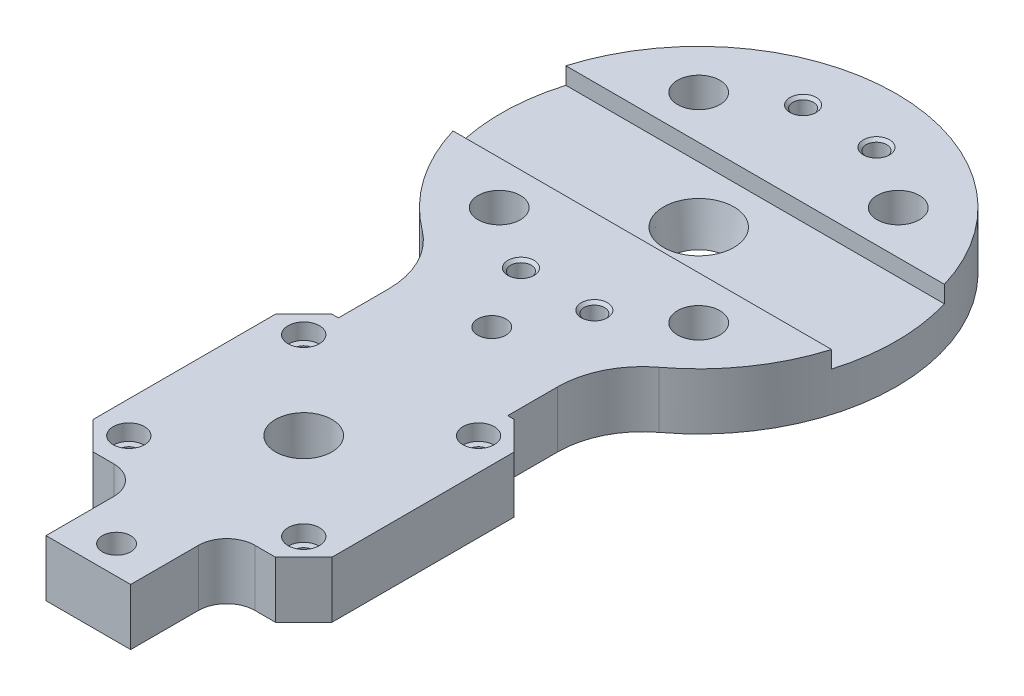
from build123d import *

# Parameters (mm, degrees)
SKETCH1_R                                      = 35
BOSS_EXTRUDE1_DEPTH                            = 10
SKETCH3_R                                      = 3.75
CUT_EXTRUDE1_DEPTH                             = 10
SKETCH4_R                                      = 5
BOSS_EXTRUDE2_DEPTH                            = 10
CBORE_FOR_4_SOCKET_HEAD_CAP_SCREW1_D           = 3.2639
CBORE_FOR_4_SOCKET_HEAD_CAP_SCREW1_CBORE_D     = 5.55752
CBORE_FOR_4_SOCKET_HEAD_CAP_SCREW1_CBORE_DEPTH = 2.8448
CHAMFER1_SIZE                                  = 5
SKETCH9_R                                      = 11.43
CUT_EXTRUDE5_DEPTH                             = 2.54
FILLET2_R                                      = 15
FILLET3_R                                      = 5
SKETCH16_R                                     = 5
CUT_EXTRUDE9_DEPTH                             = 115.130403048
CUT_EXTRUDE9_DRAFT                             = 10
SKETCH12_R                                     = 2.5
CUT_EXTRUDE6_DEPTH                             = 115.130403048
CBORE_FOR_M4_SHCS1_OUTLINE_R                   = 4.003586442
CBORE_FOR_M4_SHCS1_OUTLINE_R_2                 = 2.5
CBORE_FOR_M4_SHCS1_DEPTH                       = 4
SKETCH22_W                                     = 80
SKETCH22_H                                     = 20
CUT_EXTRUDE11_DEPTH                            = 3
SKETCH23_R                                     = 1.825
CUT_EXTRUDE12_DEPTH                            = 7
CHAMFER2_SIZE                                  = 0.5


# Read off the part's stored shape, not the designer's step: CBORE for M4 SHCS1
with BuildPart() as part:
    # Sketch1 → Boss-Extrude1 (new body)
    with BuildSketch(Plane(origin=(0, 0, 0), x_dir=(1, 0, 0), z_dir=(0, 1, 0))):
        with Locations(Location((0, 0, 0), (0, 0, 270))):
            Circle(SKETCH1_R)
    extrude(amount=BOSS_EXTRUDE1_DEPTH)

    # Sketch3 → Cut-Extrude1 (cut)
    with BuildSketch(Plane(origin=(0, 10, 0), x_dir=(1, 0, 0), z_dir=(0, 1, 0))):
        with Locations(Location((-17.67766953, 17.67766953, 0), (0, 0, 270))):
            Circle(SKETCH3_R)
        with Locations(Location((17.67766953, 17.67766953, 0), (0, 0, 270))):
            Circle(SKETCH3_R)
        with Locations(Location((17.67766953, -17.67766953, 0), (0, 0, 270))):
            Circle(SKETCH3_R)
        with Locations(Location((-17.67766953, -17.67766953, 0), (0, 0, 270))):
            Circle(SKETCH3_R)
    extrude(amount=-CUT_EXTRUDE1_DEPTH, mode=Mode.SUBTRACT)

    # Sketch4 → Boss-Extrude2 (add)
    with BuildSketch(Plane(origin=(0, 10, 0), x_dir=(1, 0, 0), z_dir=(0, 1, 0))):
        Polygon((-15, -48.85), (-21.15, -48.85), (-21.15, -91.15), (-7.5, -91.15), (-7.5, -108.17), (7.5, -108.17), (7.5, -91.15), (21.15, -91.15), (21.15, -48.85), (15, -48.85), (15, -31.622776602), (-15, -31.622776602), align=None)
        with Locations(Location((0, -70, 0), (0, 0, 270))):
            Circle(SKETCH4_R, mode=Mode.SUBTRACT)
    extrude(amount=-BOSS_EXTRUDE2_DEPTH)

    # CBORE for #4 Socket Head Cap Screw1 (through all)
    with Locations(Plane(origin=(-15.494, 10, 54.506), x_dir=(0, 0, 1), z_dir=(0, 1, 0))):
        with Locations((0, 0), (0, 30.988), (30.988, 30.988), (30.988, 0)):
            CounterBoreHole(CBORE_FOR_4_SOCKET_HEAD_CAP_SCREW1_D / 2, CBORE_FOR_4_SOCKET_HEAD_CAP_SCREW1_CBORE_D / 2, CBORE_FOR_4_SOCKET_HEAD_CAP_SCREW1_CBORE_DEPTH)

    # Chamfer1
    chamfer1_edges = [part.edges().sort_by_distance(p)[0] for p in [
        (-21.15, 5, 91.15),
        (-21.15, 5, 48.85),
        (21.15, 5, 48.85),
        (21.15, 5, 91.15),
    ]]
    chamfer(chamfer1_edges, length=CHAMFER1_SIZE)

    # Sketch9 → Cut-Extrude5 (cut)
    with BuildSketch(Plane(origin=(0, 0, 0), x_dir=(-1, 0, 0), z_dir=(0, -1, 0))):
        with Locations(Location((0, -70, 0), (0, 0, 90))):
            Circle(SKETCH9_R)
    extrude(amount=-CUT_EXTRUDE5_DEPTH, mode=Mode.SUBTRACT)

    # Fillet2
    fillet2_edges = [part.edges().sort_by_distance(p)[0] for p in [
        (-15, 5, 31.622776602),
        (15, 5, 31.622776602),
    ]]
    fillet(fillet2_edges, radius=FILLET2_R)

    # Fillet3
    fillet3_edges = [part.edges().sort_by_distance(p)[0] for p in [
        (7.5, 5, 91.15),
        (-7.5, 5, 91.15),
    ]]
    fillet(fillet3_edges, radius=FILLET3_R)


with BuildPart() as cut_extrude9_tool:
    # Sketch16 → Cut-Extrude9 (with draft: the straight prism first)
    with BuildSketch(Plane(origin=(0, 0, 0), x_dir=(-1, 0, 0), z_dir=(0, -1, 0))):
        Circle(SKETCH16_R)
    extrude(amount=-CUT_EXTRUDE9_DEPTH)
    # Cut-Extrude9: the draft: its side faces are tilted about the plane it starts from
    cut_extrude9_sides = [cut_extrude9_tool.faces().sort_by_distance(p)[0] for p in [
        (5, 57.565201524, 0),
    ]]
    draft(cut_extrude9_sides, Plane(origin=(0, 0, 0), x_dir=(-1, 0, 0), z_dir=(0, -1, 0)), CUT_EXTRUDE9_DRAFT)


with BuildPart() as part_1:
    add(part.part)

    # Cut-Extrude9: cut by cut_extrude9_tool
    add(cut_extrude9_tool.part, mode=Mode.SUBTRACT)

    # Sketch12 → Cut-Extrude6 (cut, through all)
    with BuildSketch(Plane(origin=(0, 0, 0), x_dir=(-1, 0, 0), z_dir=(0, -1, 0))):
        with Locations(Location((0, -36.67, 0), (0, 0, 90))):
            Circle(SKETCH12_R)
        with Locations(Location((0, -103.17, 0), (0, 0, 90))):
            Circle(SKETCH12_R)
    extrude(amount=-CUT_EXTRUDE6_DEPTH, mode=Mode.SUBTRACT)

    # CBORE for M4 SHCS1 outline → CBORE for M4 SHCS1 (cut)
    with BuildSketch(Plane(origin=(0, 0, 0), x_dir=(1, 0, 0), z_dir=(0, 1, 0))):
        with Locations((0, -36.67)):
            Circle(CBORE_FOR_M4_SHCS1_OUTLINE_R)
        with Locations((0, -36.67)):
            Circle(CBORE_FOR_M4_SHCS1_OUTLINE_R_2, mode=Mode.SUBTRACT)
    extrude(amount=CBORE_FOR_M4_SHCS1_DEPTH, mode=Mode.SUBTRACT)

    # Sketch22 → Cut-Extrude11 (cut)
    with BuildSketch(Plane(origin=(0, 10, 0), x_dir=(1, 0, 0), z_dir=(0, 1, 0))):
        Rectangle(SKETCH22_W, SKETCH22_H)
    extrude(amount=-CUT_EXTRUDE11_DEPTH, mode=Mode.SUBTRACT)

    # Sketch23 → Cut-Extrude12 (cut)
    with BuildSketch(Plane(origin=(0, 10, 0), x_dir=(1, 0, 0), z_dir=(0, 1, 0))):
        with Locations(Location((-6.5, 25, 0), (0, 0, 270))):
            Circle(SKETCH23_R)
        with Locations(Location((6.5, 25, 0), (0, 0, 270))):
            Circle(SKETCH23_R)
        with Locations(Location((6.5, -25, 0), (0, 0, 270))):
            Circle(SKETCH23_R)
        with Locations(Location((-6.5, -25, 0), (0, 0, 270))):
            Circle(SKETCH23_R)
    extrude(amount=-CUT_EXTRUDE12_DEPTH, mode=Mode.SUBTRACT)

    # Chamfer2
    chamfer2_edges = [part_1.edges().sort_by_distance(p)[0] for p in [
        (-6.5, 10, -26.825),
        (6.5, 10, -26.825),
        (6.5, 10, 23.175),
        (-6.5, 10, 23.175),
    ]]
    chamfer(chamfer2_edges, length=CHAMFER2_SIZE)


solid = part_1.part
